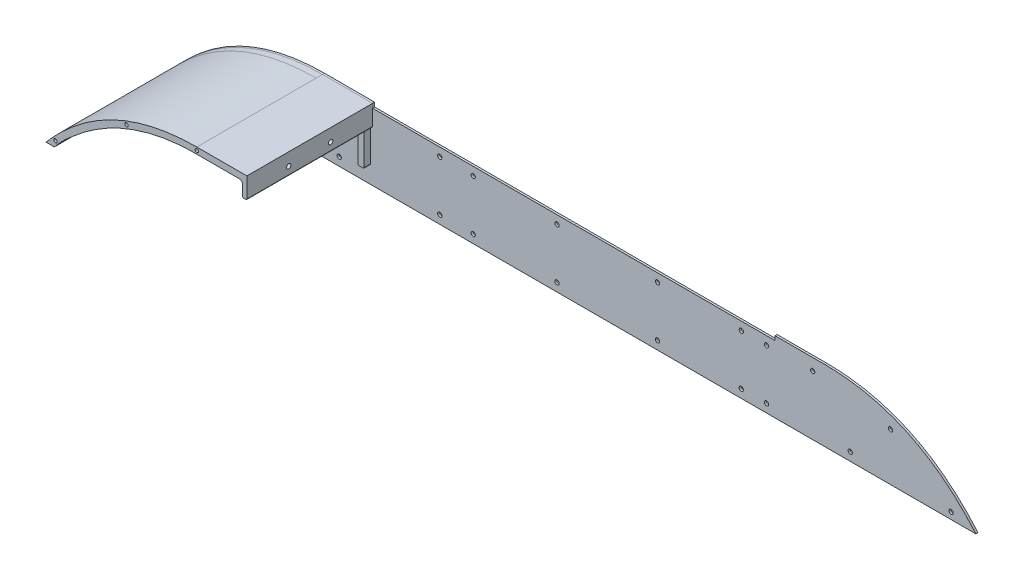
from build123d import *

# Parameters (mm, degrees)
BOSS_EXTRUDE1_DEPTH = 3.175
CUT_EXTRUDE1_DEPTH  = 921.755474233
BOSS_EXTRUDE2_DEPTH = 9.525
BOSS_EXTRUDE3_DEPTH = 180.975
SKETCH6_W           = 28.082698006
SKETCH6_H           = 28.575
CUT_EXTRUDE2_DEPTH  = 9.525
SKETCH7_R           = 3.275
CUT_EXTRUDE3_DEPTH  = 939.366939617
SKETCH8_R           = 3.325
CUT_EXTRUDE5_DEPTH  = 6.35
SKETCH9_R           = 2.6
SKETCH9_R_2         = 2.600000001
CUT_EXTRUDE6_DEPTH  = 12.7
SKETCH11_R          = 1.9
BOSS_EXTRUDE5_DEPTH = 10.16
SKETCH14_W          = 12.7
SKETCH14_H          = 9.525
BOSS_EXTRUDE8_DEPTH = 57.150234853
SKETCH17_W          = 9.525
SKETCH17_H          = 50.8
CUT_EXTRUDE9_DEPTH  = 3.175
FILLET1_R           = 5
FILLET2_R           = 2
FILLET3_R           = 1
FILLET8_R           = 5
FILLET9_R           = 1.5
FILLET10_R          = 1.5
SKETCH18_R          = 3.275
CUT_EXTRUDE10_DEPTH = 12.7


# Read off the part's stored shape, not the designer's step: Split1
with BuildPart() as part:
    # Sketch1 → Boss-Extrude1 (new body)
    with BuildSketch(Plane.XY):
        with BuildLine():
            Line((0, 0), (-304.8, 0))
            add(Edge.make_bspline(
                [(-304.8, 0), (-213.403997347, 107.359981337), (-76.2, 107.95)],
                knots=[0, 0, 0, 1, 1, 1], degree=2))
            Line((-76.2, 107.95), (0, 107.95))
            Line((0, 107.95), (609.6, 107.95))
            Line((609.6, 107.95), (685.8, 107.95))
            add(Edge.make_bspline(
                [(914.4, 0), (823.003997347, 107.359981337), (685.8, 107.95)],
                knots=[0, 0, 0, 1, 1, 1], degree=2))
            Line((914.4, 0), (609.6, 0))
            Line((609.6, 0), (0, 0))
        make_face()
    extrude(amount=BOSS_EXTRUDE1_DEPTH)

    # Sketch2 → Cut-Extrude1 (cut, through all)
    with BuildSketch(Plane.XY.offset(3.175)):
        Polygon((0, 107.95), (609.6, 107.95), (609.854, 107.95), (609.854, 101.6), (609.6, 101.6), (0, 101.6), (-0.254, 101.6), (-0.254, 107.95), align=None)
    extrude(amount=-CUT_EXTRUDE1_DEPTH, mode=Mode.SUBTRACT)

    # Sketch3 → Boss-Extrude2 (add)
    with BuildSketch(Plane.XY.offset(3.175)):
        with BuildLine():
            Line((-304.8, 0), (-254.508, 0))
            Line((-254.508, 0), (-254.508, 15.344828713))
            add(Edge.make_bspline(
                [(-254.508, 15.344828713), (-177.798332328, 82.893238953), (-76.090773332, 82.550234853)],
                knots=[0, 0, 0, 1, 1, 1], degree=2))
            Line((-76.090773332, 82.550234853), (-6.604, 82.550234853))
            Line((-6.604, 82.550234853), (-6.604, 76.2))
            Line((-6.604, 76.2), (-0.254, 76.2))
            Line((-0.254, 76.2), (-0.254, 107.95))
            Line((-0.254, 107.95), (-76.2, 107.95))
            add(Edge.make_bspline(
                [(-76.2, 107.95), (-213.403997347, 107.359981337), (-304.8, 0)],
                knots=[0, 0, 0, 1, 1, 1], degree=2))
        make_face()
    extrude(amount=BOSS_EXTRUDE2_DEPTH)

    # Sketch5 → Boss-Extrude3 (add)
    with BuildSketch(Plane.XY.offset(12.7)):
        with BuildLine():
            Line((-304.8, 0), (-292.1, 0))
            add(Edge.make_bspline(
                [(-264.999310143, 27.259023461), (-280.043189094, 15.090688978), (-292.1, 0)],
                knots=[0, 0, 0, 1, 1, 1], degree=2))
            add(Edge.make_bspline(
                [(-264.999310143, 27.259023461), (-263.324912471, 28.733451708), (-259.93755133, 31.654735884), (-253.107003874, 37.29977015), (-244.418964995, 44.024448353), (-233.76867915, 51.547177424), (-219.265929961, 60.847632169), (-200.578257731, 71.093058658), (-177.28374589, 81.152323376), (-153.155325898, 88.956116173), (-132.386582303, 93.571898544), (-115.39333326, 96.133277835), (-102.464741628, 97.490056952), (-91.537068573, 98.151901873), (-82.713415498, 98.401217113), (-78.259134389, 98.432637828), (-76.037235922, 98.425144577)],
                knots=[0.49783188, 0.49783188, 0.49783188, 0.49783188, 0.497964782, 0.498097684, 0.498363488, 0.498629292, 0.498895096, 0.499426703, 0.499958311, 0.500489919, 0.501021527, 0.501287331, 0.501553135, 0.501818938, 0.50195184, 0.502084742, 0.502084742, 0.502084742, 0.502084742], degree=3))
            Line((-76.037235922, 98.425144577), (-6.604, 98.425144577))
            Line((-6.604, 98.425144577), (-6.604, 82.550234853))
            Line((-6.604, 82.550234853), (-6.604, 76.2))
            Line((-6.604, 76.2), (-0.254, 76.2))
            Line((-0.254, 76.2), (-0.254, 107.95))
            Line((-0.254, 107.95), (-76.199999999, 107.95))
            add(Edge.make_bspline(
                [(-76.199999999, 107.95), (-213.403997347, 107.359981337), (-304.8, 0)],
                knots=[0, 0, 0, 1, 1, 1], degree=2))
        make_face()
    extrude(amount=BOSS_EXTRUDE3_DEPTH)

    # Sketch6 → Cut-Extrude2 (cut)
    with BuildSketch(Plane.XY.offset(12.7)):
        with Locations((-240.466650997, 14.2875)):
            Rectangle(SKETCH6_W, SKETCH6_H)
    extrude(amount=-CUT_EXTRUDE2_DEPTH, mode=Mode.SUBTRACT)

    # Sketch7 → Cut-Extrude3 (cut, through all)
    with BuildSketch(Plane.XY.offset(12.7)):
        with Locations((-267.208, 10.16)):
            Circle(SKETCH7_R)
        with Locations((-175.365808452, 72.622269579)):
            Circle(SKETCH7_R)
        with Locations((-57.404, 90.17019152)):
            Circle(SKETCH7_R)
    cut_extrude3 = extrude(amount=-CUT_EXTRUDE3_DEPTH, mode=Mode.SUBTRACT)

    # Sketch8 → Cut-Extrude5 (cut)
    with BuildSketch(Plane(origin=(-0.254, 0, 0), x_dir=(0, 0, -1), z_dir=(1, 0, 0))):
        with Locations((-66.675, 88.9)):
            Circle(SKETCH8_R)
        with Locations((-130.175, 88.9)):
            Circle(SKETCH8_R)
    extrude(amount=-CUT_EXTRUDE5_DEPTH, mode=Mode.SUBTRACT)

    # Sketch9 → Cut-Extrude6 (cut)
    with BuildSketch(Plane.XY.offset(193.675)):
        with Locations((-290.370830702, 9.142552388)):
            Circle(SKETCH9_R)
        with Locations((-182.759356376, 83.816480509)):
            Circle(SKETCH9_R)
        with Locations((-76.179788765, 103.250043457)):
            Circle(SKETCH9_R_2)
    extrude(amount=-CUT_EXTRUDE6_DEPTH, mode=Mode.SUBTRACT)

    # Sketch11 → Boss-Extrude5 (add)
    with BuildSketch(Plane(origin=(-254.508, 2e-09, 0), x_dir=(0, 0, -1), z_dir=(1.0, -6.037741648177811e-12, 0))):
        with Locations(Location((-7.1374, 3.975099998, 0), (0, 0, 270))):
            Circle(SKETCH11_R)
        with Locations(Location((-7.1374, 21.425099998, 0), (0, 0, 270))):
            Circle(SKETCH11_R)
    extrude(amount=BOSS_EXTRUDE5_DEPTH)

    # Sketch14 → Boss-Extrude8 (add)
    with BuildSketch(Plane.XZ.offset(-82.550234853)):
        with Locations((-6.604, 7.9375)):
            Rectangle(SKETCH14_W, SKETCH14_H)
    extrude(amount=BOSS_EXTRUDE8_DEPTH)

    # Sketch17 → Cut-Extrude9 (cut)
    with BuildSketch(Plane(origin=(-0.254, 0, 0), x_dir=(0, 0, -1), z_dir=(1, 0, 0))):
        with Locations((-7.9375, 50.8)):
            Rectangle(SKETCH17_W, SKETCH17_H)
    extrude(amount=-CUT_EXTRUDE9_DEPTH, mode=Mode.SUBTRACT)

    # Fillet1
    fillet1_edges = [part.edges().sort_by_distance(p)[0] for p in [
        (-6.604, 98.425144577, 103.1875),
    ]]
    fillet(fillet1_edges, radius=FILLET1_R)

    # Fillet2
    fillet2_edges = [part.edges().sort_by_distance(p)[0] for p in [
        (-238.394170448, 28.575, 7.9375),
        (-254.508, 28.575, 7.9375),
    ]]
    fillet(fillet2_edges, radius=FILLET2_R)

    # Fillet3
    # the kernel refuses this fillet: 1 mm, written as the material it takes off along each edge
    with BuildSketch(Plane(origin=(-292.1, 0, 12.7), x_dir=(0.6252400597778598, 0.7804324875663354, 0), z_dir=(0, 0, 1))) as fillet3_piece_1:
        with BuildLine():
            CenterArc((0.480195921, 0.999999109), FILLET3_R, 218.699809372, 51.223710378)
            Line((-0.300236566, 0.374759049), (-0.315845216, 0.362254248))
            Line((-0.315845216, 0.362254248), (-0.01560865, -0.012504801))
            Line((-0.01560865, -0.012504801), (2.669e-05, -0.019999982))
            ThreePointArc((2.669e-05, -0.019999982), (0.239430546, -0.019840221), (0.478834393, -0.019999982))
            Line((0.478834393, -0.019999982), (0.478861089, 0))
        make_face()
    extrude(amount=180.975, mode=Mode.SUBTRACT)

    # Fillet8
    fillet8_edges = [part.edges().sort_by_distance(p)[0] for p in [
        (-12.954, 82.550234853, 7.9375),
    ]]
    fillet(fillet8_edges, radius=FILLET8_R)

    # Fillet9
    fillet9_edges = [part.edges().sort_by_distance(p)[0] for p in [
        (-12.954, 25.4, 7.9375),
        (-3.429, 25.4, 7.9375),
        (-6.604, 76.2, 103.1875),
        (-0.254, 76.2, 98.425),
    ]]
    fillet(fillet9_edges, radius=FILLET9_R)

    # Fillet10
    fillet10_edges = [part.edges().sort_by_distance(p)[0] for p in [
        (-3.429, 76.2, 7.9375),
    ]]
    fillet(fillet10_edges, radius=FILLET10_R)

    # Sketch18 → Cut-Extrude10 (cut)
    with BuildSketch(Plane(origin=(0, 0, 0), x_dir=(-1, 0, 0), z_dir=(0, 0, -1))):
        with Locations((50.8, 12.7)):
            Circle(SKETCH18_R)
        with Locations((-101.6, 12.7)):
            Circle(SKETCH18_R)
        with Locations((-101.6, 88.9)):
            Circle(SKETCH18_R)
        with Locations((-558.8, 88.9)):
            Circle(SKETCH18_R)
        with Locations((-152.4, 88.9)):
            Circle(SKETCH18_R)
        with Locations((-596.9, 88.9)):
            Circle(SKETCH18_R)
        with Locations((-596.9, 12.7)):
            Circle(SKETCH18_R)
        with Locations((-558.8, 12.7)):
            Circle(SKETCH18_R)
        with Locations((-152.4, 12.7)):
            Circle(SKETCH18_R)
        with Locations((-723.9, 12.7)):
            Circle(SKETCH18_R)
        with Locations((-431.8, 88.9)):
            Circle(SKETCH18_R)
        with Locations((-431.8, 12.7)):
            Circle(SKETCH18_R)
        with Locations((-279.4, 12.7)):
            Circle(SKETCH18_R)
        with Locations((-279.4, 88.9)):
            Circle(SKETCH18_R)
    extrude(amount=-CUT_EXTRUDE10_DEPTH, mode=Mode.SUBTRACT)

    # Mirror1: Cut-Extrude3 across plane
    add(cut_extrude3.mirror(Plane(origin=(304.8, 0, 0), x_dir=(0, 0, 1), z_dir=(1, 0, 0))), mode=Mode.SUBTRACT)


with BuildPart() as body_2:
    # Split1: the piece on the far side of the plane
    add(part.part)
    split(bisect_by=Plane.XY.offset(3.175), keep=Keep.BOTTOM)


with BuildPart() as part_1:
    add(part.part)

    # Split1
    split(bisect_by=Plane.XY.offset(3.175), keep=Keep.TOP)


solid = Compound([body_2.part, part_1.part])
